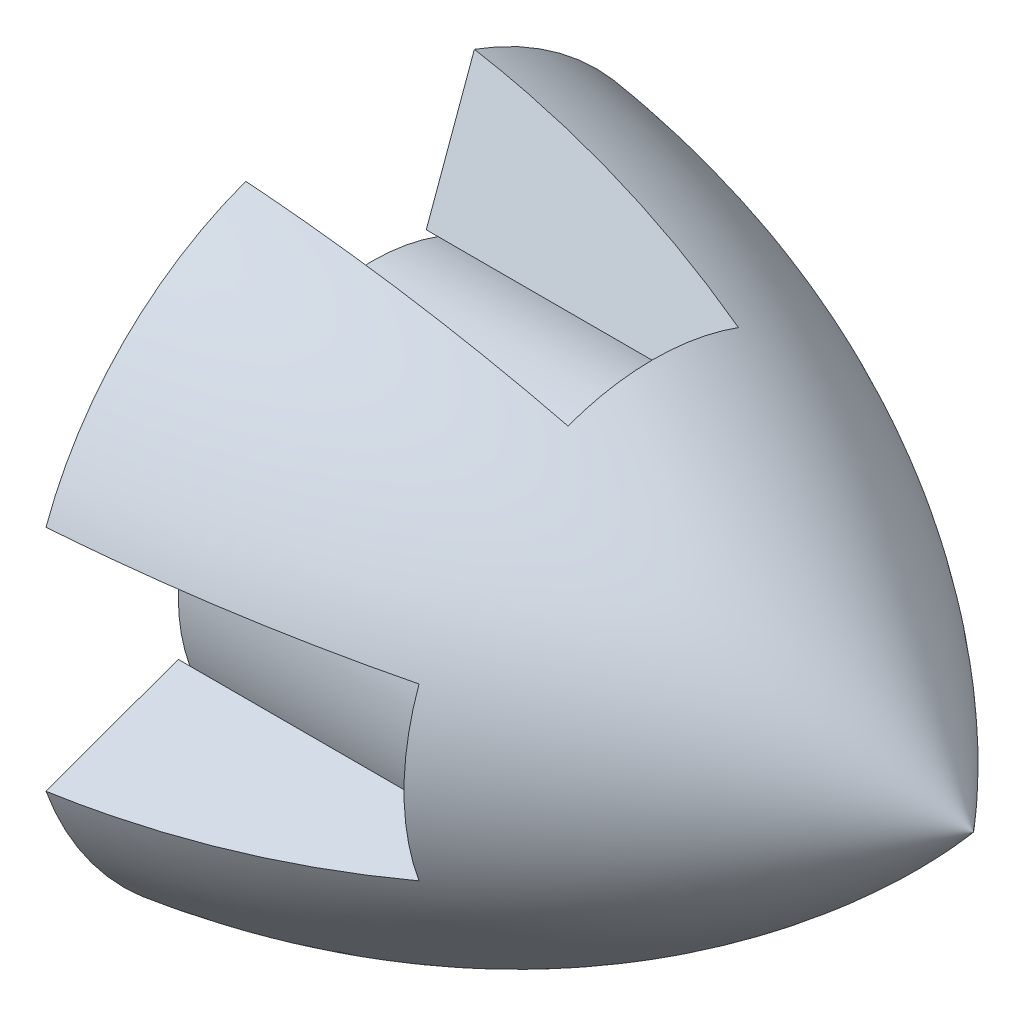
from build123d import *

# Parameters (mm, degrees)
SKETCH_7_R               = 12.6
CUT_EXTRUDE_1_DEPTH      = 15
SKETCH_8_R               = 16.5
CUT_EXTRUDE_2_DEPTH      = 1
CUT_EXTRUDE_3_DEPTH      = 25
PATTERN_CIRCULAR_1_COUNT = 4


with BuildPart() as part:
    # Эскиз2 → Повернуть1 (revolve)
    with BuildSketch(Plane.XY):
        with BuildLine():
            Line((0, 0), (0, 28.5))
            add(Edge.make_bspline(
                [(0, 28.5), (31.309007967, 24.448027272), (52.310724818, 0)],
                knots=[0, 0, 0, 1, 1, 1], degree=2))
            Line((52.310724818, 0), (28.5, 0))
            Line((28.5, 0), (0, 0))
        make_face()
    revolve(axis=Axis((-1000, 0, 0), (1, 0, 0)))

    # Эскиз7 → Вырез-Вытянуть1 (cut)
    with BuildSketch(Plane.ZY):
        Circle(SKETCH_7_R)
    extrude(amount=-CUT_EXTRUDE_1_DEPTH, mode=Mode.SUBTRACT)

    # Эскиз8 → Вырез-Вытянуть2 (cut)
    with BuildSketch(Plane.ZY):
        Circle(SKETCH_8_R)
    extrude(amount=-CUT_EXTRUDE_2_DEPTH, mode=Mode.SUBTRACT)

    # Эскиз11 → Вырез-Вытянуть3 (cut)
    with BuildSketch(Plane.ZY):
        with BuildLine():
            Line((-9.747574085, 26.781239692), (-5.643332365, 15.504928243))
            ThreePointArc((-5.643332365, 15.504928243), (0, 16.5), (5.643332365, 15.504928243))
            Line((5.643332365, 15.504928243), (9.747574085, 26.781239692))
            ThreePointArc((9.747574085, 26.781239692), (0, 28.5), (-9.747574085, 26.781239692))
        make_face()
    cut_extrude_3 = extrude(amount=-CUT_EXTRUDE_3_DEPTH, mode=Mode.SUBTRACT)

    # Круговой массив1: Вырез-Вытянуть3 ×4 about axis
    pattern_circular_1_axis = Axis((1, 0, 0), (-1, 0, 0))
    for i in range(1, PATTERN_CIRCULAR_1_COUNT):
        add(cut_extrude_3.rotate(pattern_circular_1_axis, i * 360 / PATTERN_CIRCULAR_1_COUNT), mode=Mode.SUBTRACT)


solid = part.part
